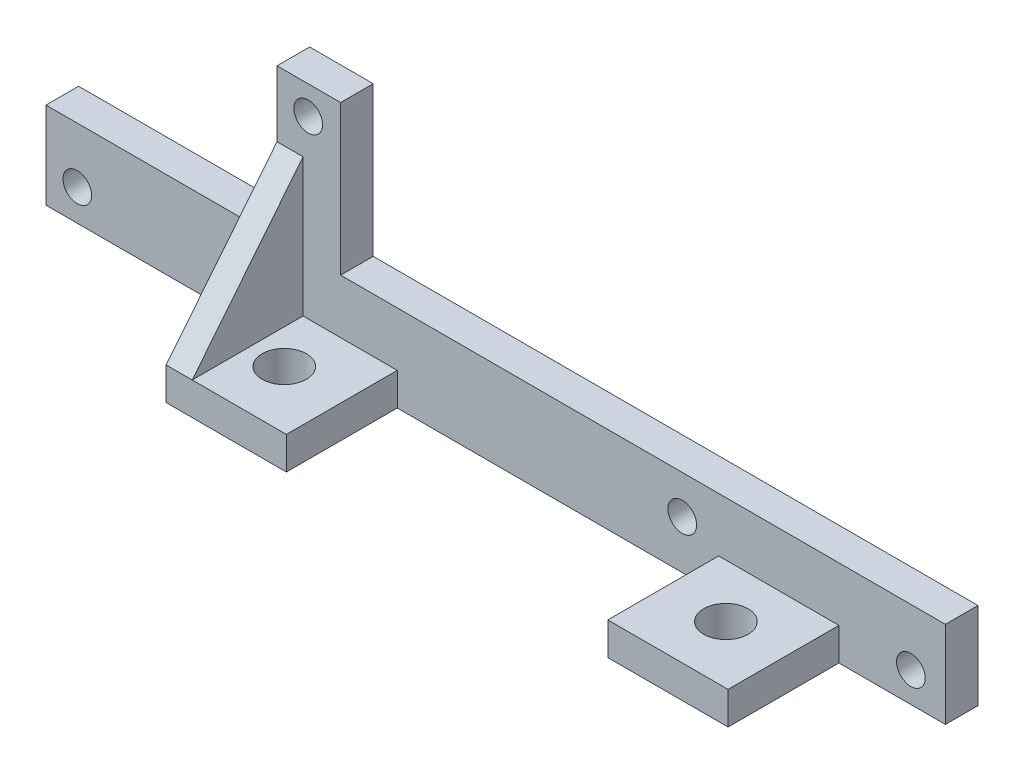
from build123d import *

# Parameters (mm, degrees)
SKETCH1_W           = 86
SKETCH1_H           = 23
BOSS_EXTRUDE1_DEPTH = 3.175
BOSS_EXTRUDE2_DEPTH = 3.175
SKETCH18_R          = 2.159
CUT_EXTRUDE2_DEPTH  = 127
SKETCH19_R          = 1.397
CUT_EXTRUDE3_DEPTH  = 47.652019249
SKETCH28_W          = 1.563549178
SKETCH28_H          = 8.443792612
BOSS_EXTRUDE4_DEPTH = 3.175
SKETCH27_W          = 57.315527743
SKETCH27_H          = 14.55620742
SKETCH27_W_2        = 22.489872753
CUT_EXTRUDE5_DEPTH  = 3.175
SKETCH29_W          = 13.689872798
SKETCH29_H          = 10.795
SKETCH29_W_2        = 13.689872764
CUT_EXTRUDE6_DEPTH  = 50.8
RIB3_REACH          = 68.958
SKETCH30_WALL_W     = 153.142504754
SKETCH30_WALL_H     = 2.54


with BuildPart() as part:
    # Sketch1 → Boss-Extrude1 (new body)
    with BuildSketch(Plane.XY):
        Rectangle(SKETCH1_W, SKETCH1_H)
    extrude(amount=-BOSS_EXTRUDE1_DEPTH)

    # Sketch3 → Boss-Extrude2 (add)
    with BuildSketch(Plane(origin=(0, -11.5, 0), x_dir=(-1, 0, 0), z_dir=(0, -1, 0))):
        Polygon((34.200000011, 0), (34.200000011, -10.795), (8.80000001, -10.795), (8.800000011, 0), align=None)
        Polygon((-34.200000011, 0), (-34.200000011, -10.795), (-8.80000001, -10.795), (-8.800000011, 0), align=None)
    extrude(amount=-BOSS_EXTRUDE2_DEPTH)

    # Sketch18 → Cut-Extrude2 (cut)
    with BuildSketch(Plane(origin=(0, 11.5, 0), x_dir=(1, 0, 0), z_dir=(0, 1, 0))):
        with Locations((-14.626260209, -5.177433052)):
            Circle(SKETCH18_R)
        with Locations((28.373739812, -5.177433052)):
            Circle(SKETCH18_R)
    extrude(amount=-CUT_EXTRUDE2_DEPTH, mode=Mode.SUBTRACT)

    # Sketch19 → Cut-Extrude3 (cut, through all)
    with BuildSketch(Plane(origin=(0, 0, -3.175), x_dir=(-1, 0, 0), z_dir=(0, 0, -1))):
        with Locations((-41.206, -8.579)):
            Circle(SKETCH19_R)
        with Locations((-18.9429, -6.801)):
            Circle(SKETCH19_R)
        with Locations((17.473, 8.7438)):
            Circle(SKETCH19_R)
        with Locations((39.952, -8.452)):
            Circle(SKETCH19_R)
    extrude(amount=-CUT_EXTRUDE3_DEPTH, mode=Mode.SUBTRACT)

    # Sketch28 → Boss-Extrude4 (add)
    with BuildSketch(Plane(origin=(0, 0, -3.175), x_dir=(-1, 0, 0), z_dir=(0, 0, -1))):
        with Locations((-43.781774589, -7.278103694)):
            Rectangle(SKETCH28_W, SKETCH28_H)
    extrude(amount=-BOSS_EXTRUDE4_DEPTH)

    # Sketch27 → Cut-Extrude5 (cut)
    with BuildSketch(Plane(origin=(0, 0, -3.175), x_dir=(-1, 0, 0), z_dir=(0, 0, -1))):
        with Locations((-14.342236128, 4.22189629)):
            Rectangle(SKETCH27_W, SKETCH27_H)
        with Locations((31.755063623, 4.22189629)):
            Rectangle(SKETCH27_W_2, SKETCH27_H)
    extrude(amount=-CUT_EXTRUDE5_DEPTH, mode=Mode.SUBTRACT)

    # Sketch29 → Cut-Extrude6 (cut)
    with BuildSketch(Plane(origin=(0, 11.5, 0), x_dir=(1, 0, 0), z_dir=(0, 1, 0))):
        with Locations((15.644936409, -5.3975)):
            Rectangle(SKETCH29_W, SKETCH29_H)
        with Locations((-27.355063629, -5.3975)):
            Rectangle(SKETCH29_W_2, SKETCH29_H)
    extrude(amount=-CUT_EXTRUDE6_DEPTH, mode=Mode.SUBTRACT)

    # Sketch30 wall → Rib3 (add, up to next)
    with BuildSketch(Plane(origin=(-20.510127247, -1.612609393, 5.3975), x_dir=(0, -0.779303981028, 0.626646076468), z_dir=(0, 0.626646076468, 0.779303981028)), mode=Mode.PRIVATE) as rib3_sk1:
        with Locations((0, 1.27)):
            Rectangle(SKETCH30_WALL_W, SKETCH30_WALL_H)
    rib3_tool1 = extrude(rib3_sk1.sketch, amount=-RIB3_REACH, mode=Mode.PRIVATE) - part.part
    add(rib3_tool1.solids().sort_by_distance((-20.510127247, -1.612609393, 5.3975))[0])


solid = part.part
